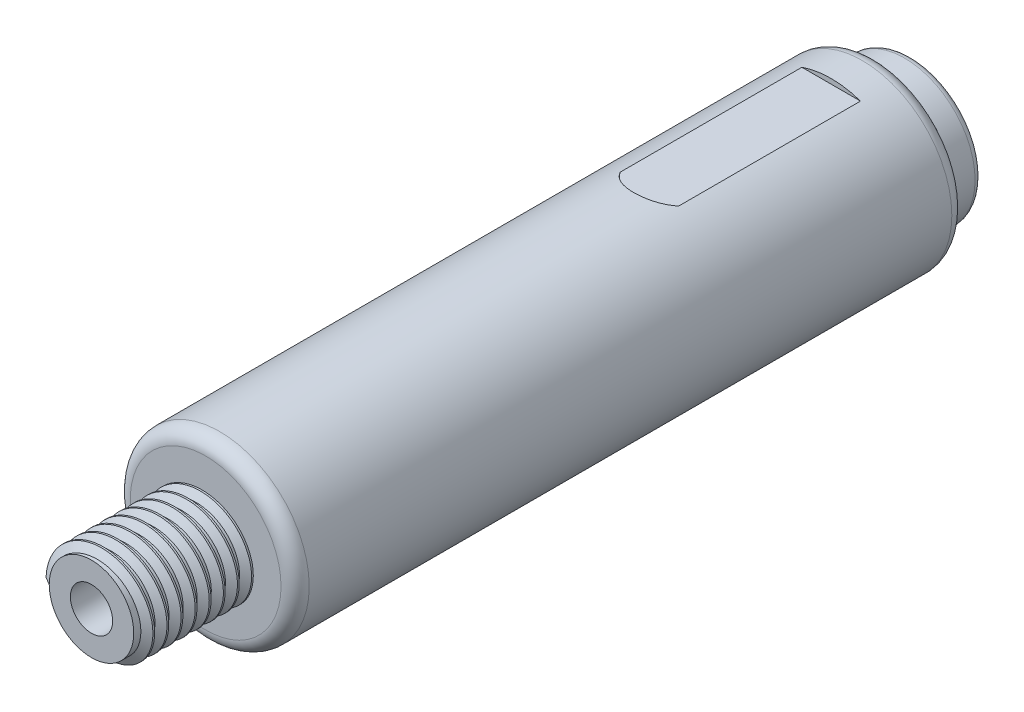
from build123d import *

# Parameters (mm, degrees)
SKETCH2_W          = 8.1
SKETCH2_H          = 1.5
SKETCH2_W_2        = 2.5
SKETCH2_H_2        = 2
FILLET1_R          = 1
FILLET2_R          = 0.5
THREAD1_PITCH      = 1
SKETCH6_W          = 4.968022122
SKETCH6_H          = 11.533228113
CUT_EXTRUDE1_DEPTH = 10


with BuildPart() as part:
    # Sketch2 → Revolve1 (revolve)
    with BuildSketch(Plane(origin=(0, 0, 0), x_dir=(0, 0, -1), z_dir=(1, 0, 0)), mode=Mode.PRIVATE) as revolve1_sk:
        Polygon((-15.8, 3), (23.8, 3), (23.8, 5), (23.8, 6.35), (-23.8, 6.35), (-23.8, 3), align=None)
        Polygon((-23.8, 1.5), (-15.8, 3), (-23.8, 3), align=None)
        with Locations((-27.85, 2.25)):
            Rectangle(SKETCH2_W, SKETCH2_H)
        with Locations((25.05, 4)):
            Rectangle(SKETCH2_W_2, SKETCH2_H_2)
    revolve(revolve1_sk.sketch.rotate(Axis((0, 0, 0), (0, 0, -1)), 90), axis=Axis((0, 0, 0), (0, 0, -1)))

    # Fillet1
    fillet1_edges = [part.edges().sort_by_distance(p)[0] for p in [
        (-6.35, 0, 23.8),
        (-6.35, 0, -23.8),
    ]]
    fillet(fillet1_edges, radius=FILLET1_R)

    # Fillet2
    fillet2_edges = [part.edges().sort_by_distance(p)[0] for p in [
        (-5, 0, -26.3),
    ]]
    fillet(fillet2_edges, radius=FILLET2_R)

    # Thread1: the profile of Thread Profile1 profile screwed along a right-hand helix of 8 turns, 8 arcs to a turn; built about Z, then put on its axis
    thread1_z = Axis((0, 0, 0), (0, 0, 1))
    thread1_corners = [(2.9997, 0, -0.000173205), (3.541265875, 0, 0.312499999), (3.541265875, 0, 0.437499999), (2.9997, 0, 0.750173202)]
    with BuildLine(mode=Mode.PRIVATE) as thread1_profile:
        Line(thread1_corners[0], thread1_corners[1])
        Line(thread1_corners[1], thread1_corners[2])
        Line(thread1_corners[2], thread1_corners[3])
        Line(thread1_corners[3], thread1_corners[0])
    thread1_cap = Face(thread1_profile.wire())
    thread1_turn_angles = [0, 22.5, 45, 67.5, 90, 112.5, 135, 157.5, 180, 202.5, 225, 247.5, 270, 292.5, 315, 337.5, 360]
    thread1_turn_weights = [1, 0.9238795325112867, 1, 0.9238795325112867, 1, 0.9238795325112867, 1, 0.9238795325112867, 1, 0.9238795325112867, 1, 0.9238795325112867, 1, 0.9238795325112867, 1, 0.9238795325112867, 1]
    thread1_turn_rails = [Edge.make_bspline([Vector(p[0], p[1], 0).rotate(thread1_z, thread1_turn_angles[k]) / thread1_turn_weights[k] + Vector(0, 0, p[2] + THREAD1_PITCH * thread1_turn_angles[k] / 360) for k in range(17)], [0, 0, 0, 1, 1, 2, 2, 3, 3, 4, 4, 5, 5, 6, 6, 7, 7, 8, 8, 8], 2, thread1_turn_weights) for p in thread1_corners]
    thread1_turn_sides = [Face.make_surface_from_curves(thread1_turn_rails[p[0]], thread1_turn_rails[p[1]]) for p in [(0, 1), (1, 2), (2, 3), (3, 0)]]
    thread1 = Plane(origin=(0, 0, 31.9), x_dir=(-1, 0, 0), z_dir=(0, 0, -1)) * Solid(Shell([*[p.moved(Location((0, 0, THREAD1_PITCH * i))) for i in range(8) for p in thread1_turn_sides], thread1_cap, thread1_cap.rotate(thread1_z, 2880).moved(Location((0, 0, THREAD1_PITCH * 2880 / 360)))]))
    add(thread1)

    # Sketch6 → Cut-Extrude1 (cut)
    with BuildSketch(Plane(origin=(0, 6, 0), x_dir=(1, 0, 0), z_dir=(0, 1, 0))):
        with BuildLine():
            Line((-2.484011061, 9.055026504), (2.484011061, 9.055026504))
            ThreePointArc((2.484011061, 9.055026504), (0, 6.571015443), (-2.484011061, 9.055026504))
        make_face()
        with Locations((0, 14.821640561)):
            Rectangle(SKETCH6_W, SKETCH6_H)
    extrude(amount=CUT_EXTRUDE1_DEPTH, mode=Mode.SUBTRACT)


solid = part.part
